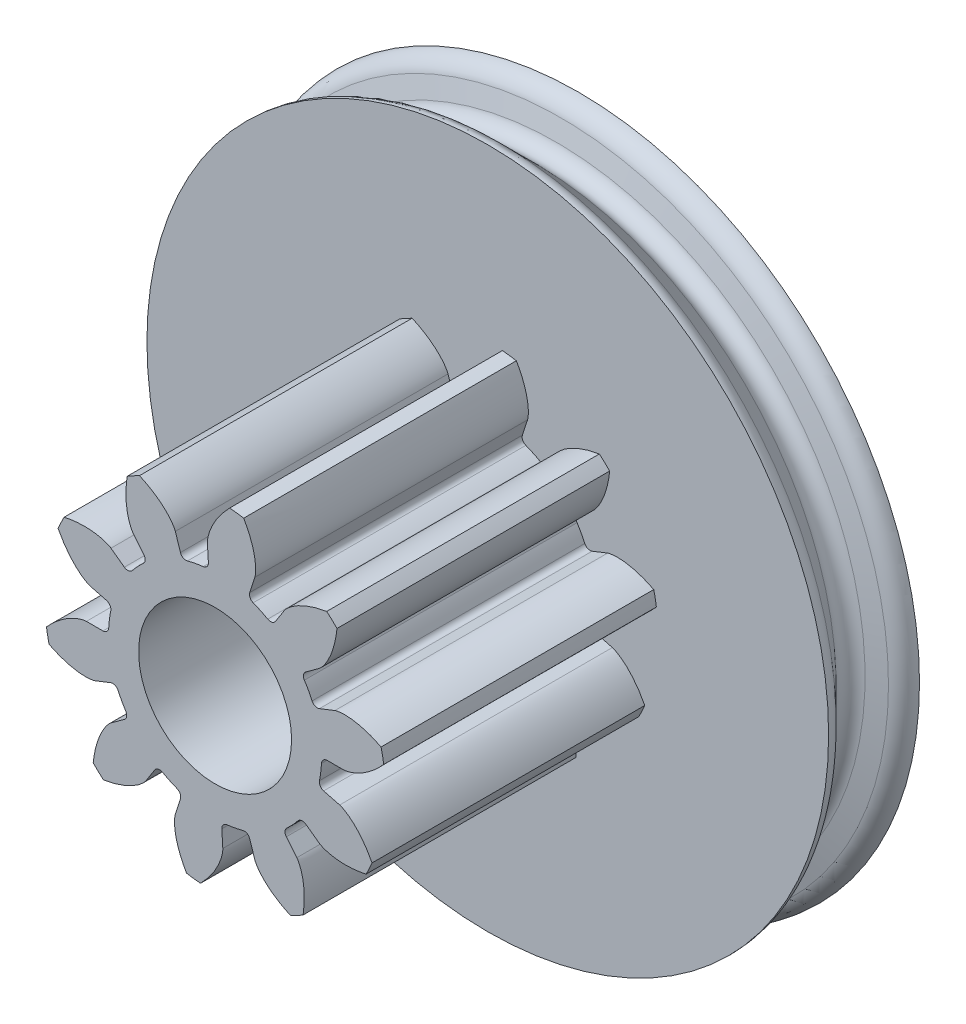
from build123d import *

# Parameters (mm, degrees)
SKETCH2_R                = 7.5
BOSS_EXTRUDE1_DEPTH      = 12
CUT_EXTRUDE1_DEPTH       = 12
FILLET1_R                = 0.254
CIRPATTERN3_COUNT        = 10
FILLET1_OF_CIRPATTERN3_R = 0.254
SKETCH5_R                = 3.3655
CUT_EXTRUDE2_DEPTH       = 27.570660624
FILLET2_R                = 1


# Read off the part's stored shape, not the designer's step: Cut-Extrude1
with BuildPart() as part:
    # Sketch2 → Boss-Extrude1 (new body)
    with BuildSketch(Plane.XY):
        Circle(SKETCH2_R)
    extrude(amount=BOSS_EXTRUDE1_DEPTH)

    # Cut-Extrude1 outline → Cut-Extrude1 (cut)
    with BuildSketch(Plane.XY):
        with BuildLine():
            add(Edge.make_bspline(
                [(6.908254231, -2.919935526), (6.893561306, -2.891484392), (6.858908317, -2.825752949), (6.801030628, -2.719894481), (6.719723085, -2.58478424), (6.626115091, -2.440113011), (6.527745066, -2.302085438), (6.422879078, -2.166713445), (6.314345277, -2.039755658), (6.214137539, -1.933006771), (6.124816582, -1.846052106), (6.048046187, -1.776576314), (5.98307883, -1.721409233), (5.916295348, -1.668340855), (5.847674043, -1.617740845), (5.777181002, -1.569876944), (5.710709014, -1.528901349), (5.648784764, -1.494445809), (5.595035387, -1.467766355), (5.552668527, -1.448973679), (5.518798859, -1.435886737), (5.497736399, -1.428758921), (5.486438018, -1.425539777), (5.482383967, -1.424486414)],
                knots=[0.231950944, 0.231950944, 0.231950944, 0.231950944, 0.231950944, 0.273661934, 0.328394301, 0.383126635, 0.43785898, 0.492591256, 0.547323565, 0.602055884, 0.652783571, 0.680149903, 0.707515961, 0.734882063, 0.762248421, 0.789614741, 0.816980391, 0.844236067, 0.862480777, 0.880559096, 0.894007228, 0.903714168, 0.909090916, 0.909090916, 0.909090916, 0.909090916, 0.909090916], degree=4))
            ThreePointArc((6.908254231, -2.919935526), (7.439498394, -0.950717438), (7.420544998, 1.088812167))
            add(Edge.make_bspline(
                [(5.664423669, 0), (5.668612333, 0), (5.680357163, 0.000274378), (5.702535229, 0.001876348), (5.738607513, 0.006025183), (5.784338786, 0.013559515), (5.843070135, 0.025864695), (5.911669164, 0.043640245), (5.986309439, 0.066582649), (6.066573808, 0.095180776), (6.14571467, 0.126897783), (6.223697515, 0.161466007), (6.300450382, 0.198522205), (6.392225315, 0.246459047), (6.500543047, 0.308156828), (6.624375527, 0.386274894), (6.761348618, 0.481858566), (6.896887768, 0.586508412), (7.026807544, 0.695362097), (7.153789071, 0.811843482), (7.266461058, 0.922164454), (7.349099945, 1.010065857), (7.399169388, 1.064970348), (7.420544998, 1.088812167)],
                knots=[0, 0, 0, 0, 0, 0.005376748, 0.015083688, 0.02853182, 0.046610139, 0.064854849, 0.092110525, 0.119476175, 0.146842495, 0.174208853, 0.201574955, 0.228941013, 0.256307345, 0.307035032, 0.361767351, 0.41649966, 0.471231936, 0.525964281, 0.580696615, 0.635428982, 0.677139972, 0.677139972, 0.677139972, 0.677139972, 0.677139972], degree=4))
            Line((5.664423669, 0), (4.6875, 0))
            ThreePointArc((4.6875, 0), (4.649686496, -0.594198398), (4.536856059, -1.178810141))
            Line((4.536856059, -1.178810141), (5.482383967, -1.424486414))
        make_face()
    cut_extrude1 = extrude(amount=CUT_EXTRUDE1_DEPTH, mode=Mode.SUBTRACT)

    # Fillet1
    fillet1_edges = [part.edges().sort_by_distance(p)[0] for p in [
        (4.536856059, -1.178810141, 6),
        (4.6875, 0, 6),
    ]]
    fillet(fillet1_edges, radius=FILLET1_R)

    # CirPattern3: Cut-Extrude1 ×10 about axis
    cirpattern3_axis = Axis((0, 0, 55), (0, 0, -1))
    for i in range(1, CIRPATTERN3_COUNT):
        add(cut_extrude1.rotate(cirpattern3_axis, i * 360 / CIRPATTERN3_COUNT), mode=Mode.SUBTRACT)

    # Fillet1 of CirPattern3
    fillet1_of_cirpattern3_edges = [part.edges().sort_by_distance(p)[0] for p in [
        (2.977506437, -3.62037452, 6),
        (3.792267161, -2.75524337, 6),
        (0.280850557, -4.679078885, 6),
        (1.448517161, -4.45807742, 6),
        (-2.523080689, -3.950534152, 6),
        (-1.448517161, -4.45807742, 6),
        (-4.363280869, -1.713019646, 6),
        (-3.792267161, -2.75524337, 6),
        (-4.536856059, 1.178810141, 6),
        (-4.6875, 0, 6),
        (-2.977506437, 3.62037452, 6),
        (-3.792267161, 2.75524337, 6),
        (-0.280850557, 4.679078885, 6),
        (-1.448517161, 4.45807742, 6),
        (2.523080689, 3.950534152, 6),
        (1.448517161, 4.45807742, 6),
        (4.363280869, 1.713019646, 6),
        (3.792267161, 2.75524337, 6),
    ]]
    fillet(fillet1_of_cirpattern3_edges, radius=FILLET1_OF_CIRPATTERN3_R)

    # Sketch4 → Revolve1 (revolve)
    with BuildSketch(Plane(origin=(0, 0, 0), x_dir=(1, 0, 0), z_dir=(0, 1, 0))):
        with BuildLine():
            Line((0, 0), (-15, 0))
            ThreePointArc((-15, 0), (-14.939103626, 0.306146746), (-14.765685425, 0.565685425))
            Line((-14.765685425, 0.565685425), (-13.325627707, 2.005743143))
            ThreePointArc((-13.325627707, 2.005743143), (-13.170336279, 2.585298639), (-13.594600348, 3.009562708))
            Line((-13.594600348, 3.009562708), (-14.407055236, 3.227259339))
            ThreePointArc((-14.407055236, 3.227259339), (-14.834682672, 3.512990857), (-15, 4))
            Line((-15, 4), (0, 4))
            Line((0, 4), (0, 0))
        make_face()
    revolve(axis=Axis((0, 0, -4), (0, 0, 1)))

    # Sketch5 → Cut-Extrude2 (cut, through all)
    with BuildSketch(Plane.XY.offset(12)):
        Circle(SKETCH5_R)
    extrude(amount=-CUT_EXTRUDE2_DEPTH, mode=Mode.SUBTRACT)

    # Fillet2
    fillet2_edges = [part.edges().sort_by_distance(p)[0] for p in [
        (-3.3655, 0, -4),
    ]]
    fillet(fillet2_edges, radius=FILLET2_R)


solid = part.part
